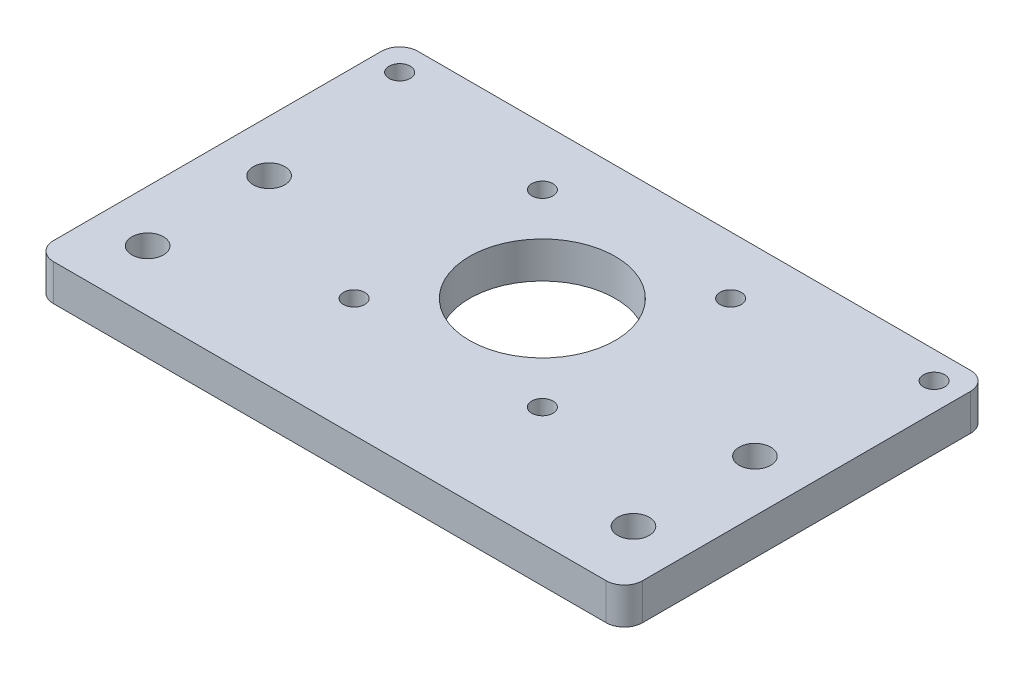
from build123d import *

# Parameters (mm, degrees)
SKETCH1_W                     = 97
SKETCH1_H                     = 60
BASE_DEPTH                    = 6
SKETCH2_R                     = 12
STEPPERCASEHOLE_DEPTH         = 58.343264644
FILLETEDGES3MM_R              = 3
F_3_5MM_CABLETIEHOLES_D       = 3.5
F_5_2_5_2_HOLESFORCORNERS_D   = 5.2
F_3_5_3_5_STEPPERMOUNTHOLES_D = 3.5


with BuildPart() as part:
    # Sketch1 → Base (new body)
    with BuildSketch(Plane(origin=(0, 0, 0), x_dir=(1, 0, 0), z_dir=(0, 1, 0))):
        Rectangle(SKETCH1_W, SKETCH1_H)
    extrude(amount=BASE_DEPTH)

    # Sketch2 → StepperCaseHole (cut, through all)
    with BuildSketch(Plane(origin=(0, 6, 0), x_dir=(1, 0, 0), z_dir=(0, 1, 0))):
        with Locations((0, 5)):
            Circle(SKETCH2_R)
    extrude(amount=-STEPPERCASEHOLE_DEPTH, mode=Mode.SUBTRACT)

    # FilletEdges3mm
    filletedges3mm_edges = [part.edges().sort_by_distance(p)[0] for p in [
        (48.5, 3, 30),
        (48.5, 3, -30),
        (-48.5, 3, -30),
        (-48.5, 3, 30),
    ]]
    fillet(filletedges3mm_edges, radius=FILLETEDGES3MM_R)

    # Ø3.5mm CableTieHoles (through all)
    with Locations(Plane(origin=(0, 0, 0), x_dir=(-1, 0, 0), z_dir=(0, -1, 0))):
        with Locations((-44, 25.5), (44, 25.5)):
            Hole(F_3_5MM_CABLETIEHOLES_D / 2)

    # Ø5.2 (5.2) HolesForCorners (through all)
    with Locations(Plane(origin=(0, 6, 0), x_dir=(1, 0, 0), z_dir=(0, 1, 0))):
        with Locations((-40, 0), (-40, -20), (40, 0), (40, -20)):
            Hole(F_5_2_5_2_HOLESFORCORNERS_D / 2)

    # Ø3.5 (3.5) StepperMountHoles (through all)
    with Locations(Plane(origin=(0, 6, 0), x_dir=(1, 0, 0), z_dir=(0, 1, 0))):
        with Locations((-15.5, 20.5), (-15.5, -10.5), (15.5, -10.5), (15.5, 20.5)):
            Hole(F_3_5_3_5_STEPPERMOUNTHOLES_D / 2)


solid = part.part
